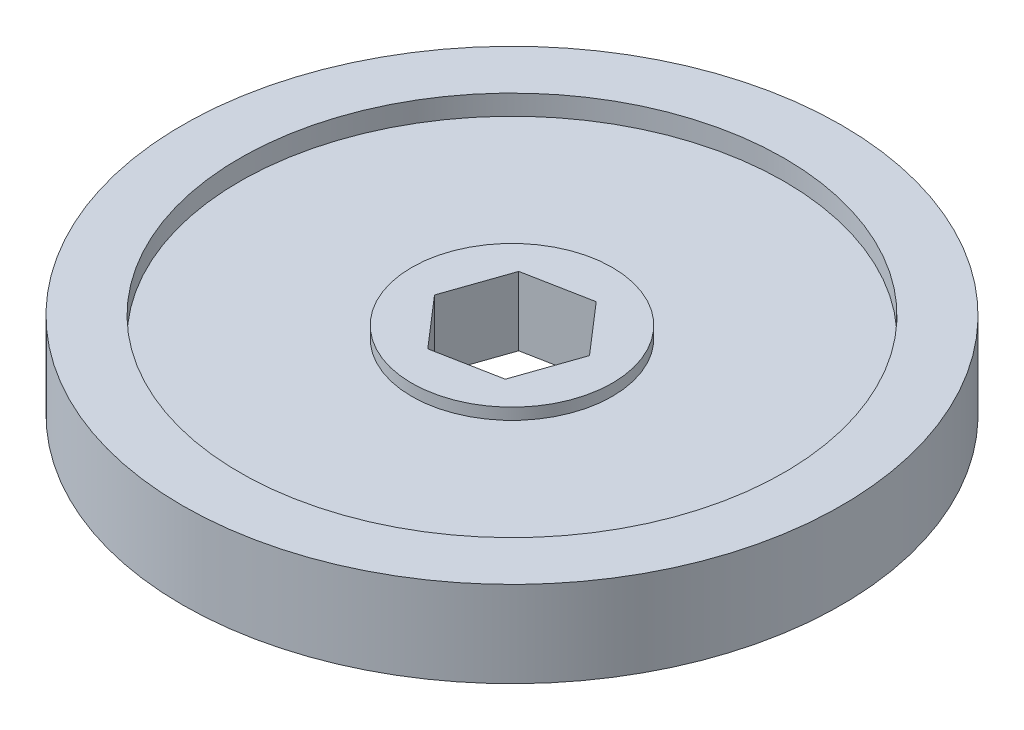
from build123d import *

# Parameters (mm, degrees)
SKETCH1_R            = 36.5125
SKETCH1_R_2          = 30.1625
RIM_DEPTH            = 9.525
INNER_HUB_DEPTH      = 2.54
INNER_HUB_DEPTH_BACK = 2.54
SKETCH2_R            = 30.1625
SKETCH3_R            = 11.1125
HEX_STEP_DEPTH       = 1.27


with BuildPart() as part:
    # Sketch1 → Rim (new body)
    with BuildSketch(Plane(origin=(0, 0, 0), x_dir=(1, 0, 0), z_dir=(0, 1, 0))):
        Circle(SKETCH1_R)
        Circle(SKETCH1_R_2, mode=Mode.SUBTRACT)
    extrude(amount=RIM_DEPTH)

    # Sketch2 → Inner_Hub (add, two sides: drawn at the far end of the back side and taken through both)
    with BuildSketch(Plane(origin=(0, 4.7625, 0), x_dir=(1, 0, 0), z_dir=(0, 1, 0)).offset(-INNER_HUB_DEPTH_BACK)):
        Circle(SKETCH2_R)
        Polygon((7.200760698, 1.382887815), (2.402764371, 6.927485598), (-4.797996327, 5.544597783), (-7.200760698, -1.382887815), (-2.402764371, -6.927485598), (4.797996327, -5.544597783), align=None, mode=Mode.SUBTRACT)
    extrude(amount=INNER_HUB_DEPTH + INNER_HUB_DEPTH_BACK)

    # Sketch3 → Hex_Step (add)
    with BuildSketch(Plane.XZ.offset(-2.2225)):
        Circle(SKETCH3_R)
        Polygon((4.797996327, 5.544597783), (-2.402764371, 6.927485598), (-7.200760698, 1.382887815), (-4.797996327, -5.544597783), (2.402764371, -6.927485598), (7.200760698, -1.382887815), align=None, mode=Mode.SUBTRACT)
    hex_step = extrude(amount=HEX_STEP_DEPTH)

    # Mirror1: Hex_Step across plane
    add(hex_step.mirror(Plane.ZX.offset(4.7625)))


solid = part.part
